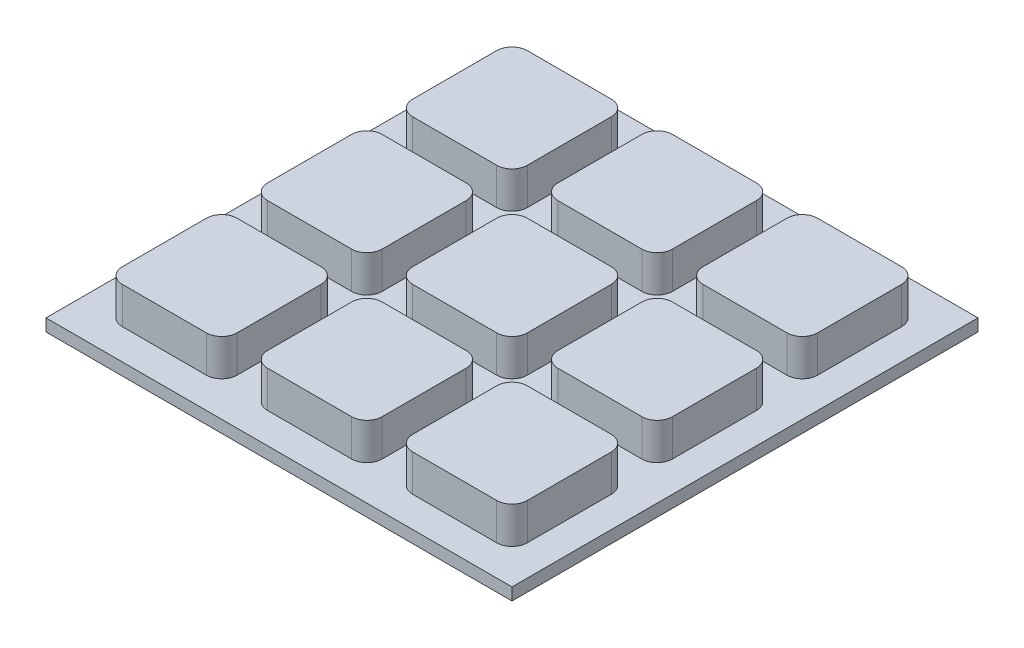
from build123d import *

# Parameters (mm, degrees)
SKETCH1_W           = 61
SKETCH1_H           = 61
BOSS_EXTRUDE1_DEPTH = 1.6
SKETCH2_W           = 15
SKETCH2_H           = 15
BOSS_EXTRUDE2_DEPTH = 4.8
FILLET1_R           = 2


with BuildPart() as part:
    # Sketch1 → Boss-Extrude1 (new body)
    with BuildSketch(Plane(origin=(0, 0, 0), x_dir=(1, 0, 0), z_dir=(0, 1, 0))):
        Rectangle(SKETCH1_W, SKETCH1_H)
    extrude(amount=BOSS_EXTRUDE1_DEPTH)

    # Sketch2 → Boss-Extrude2 (add)
    with BuildSketch(Plane(origin=(0, 1.6, 0), x_dir=(1, 0, 0), z_dir=(0, 1, 0))):
        with Locations((-19, 19)):
            Rectangle(SKETCH2_W, SKETCH2_H)
        with Locations((0, 19)):
            Rectangle(SKETCH2_W, SKETCH2_H)
        with Locations((19, 19)):
            Rectangle(SKETCH2_W, SKETCH2_H)
        with Locations((19, 0)):
            Rectangle(SKETCH2_W, SKETCH2_H)
        Rectangle(SKETCH2_W, SKETCH2_H)
        with Locations((-19, 0)):
            Rectangle(SKETCH2_W, SKETCH2_H)
        with Locations((-19, -19)):
            Rectangle(SKETCH2_W, SKETCH2_H)
        with Locations((0, -19)):
            Rectangle(SKETCH2_W, SKETCH2_H)
        with Locations((19, -19)):
            Rectangle(SKETCH2_W, SKETCH2_H)
    extrude(amount=BOSS_EXTRUDE2_DEPTH)

    # Fillet1
    fillet1_edges = [part.edges().sort_by_distance(p)[0] for p in [
        (26.5, 4, -11.5),
        (26.5, 4, -26.5),
        (11.5, 4, -26.5),
        (11.5, 4, -11.5),
        (-7.5, 4, -11.5),
        (7.5, 4, -11.5),
        (7.5, 4, -26.5),
        (-7.5, 4, -26.5),
        (-26.5, 4, -26.5),
        (-11.5, 4, -26.5),
        (-11.5, 4, -11.5),
        (-26.5, 4, -11.5),
        (-11.5, 4, 11.5),
        (-11.5, 4, 26.5),
        (-26.5, 4, 26.5),
        (-26.5, 4, 11.5),
        (-7.5, 4, 11.5),
        (-7.5, 4, 26.5),
        (7.5, 4, 11.5),
        (7.5, 4, 26.5),
        (26.5, 4, 26.5),
        (11.5, 4, 26.5),
        (11.5, 4, 11.5),
        (26.5, 4, 11.5),
        (11.5, 4, -7.5),
        (26.5, 4, -7.5),
        (26.5, 4, 7.5),
        (11.5, 4, 7.5),
        (7.5, 4, 7.5),
        (7.5, 4, -7.5),
        (-7.5, 4, 7.5),
        (-7.5, 4, -7.5),
        (-26.5, 4, -7.5),
        (-11.5, 4, -7.5),
        (-11.5, 4, 7.5),
        (-26.5, 4, 7.5),
    ]]
    fillet(fillet1_edges, radius=FILLET1_R)


solid = part.part
